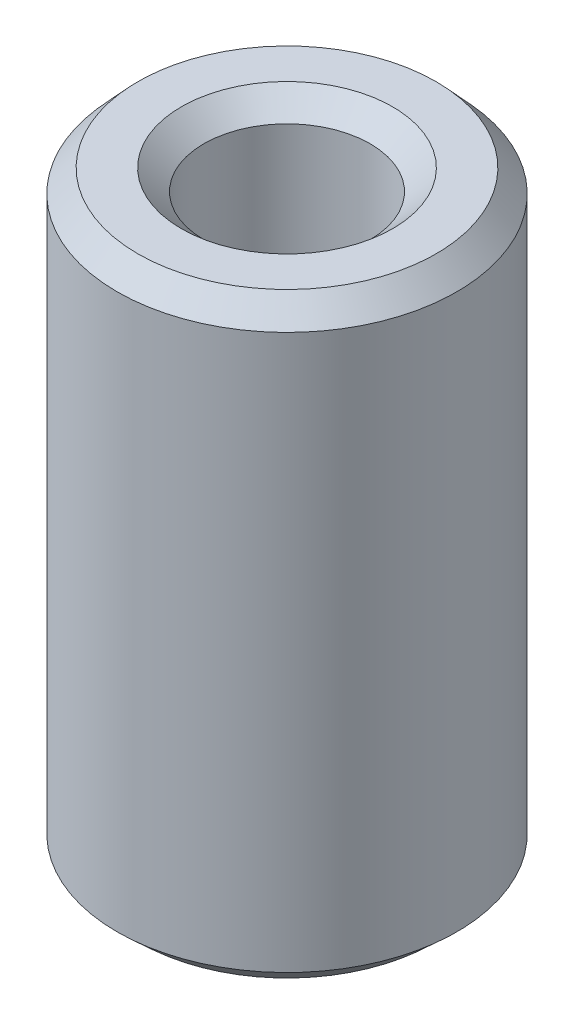
from build123d import *
from OCP.BRepFilletAPI import BRepFilletAPI_MakeChamfer

# Parameters (mm, degrees)
SKETCH1_R           = 15
BOSS_EXTRUDE1_DEPTH = 52.776280472
SKETCH2_R           = 7.339564061
CUT_EXTRUDE1_DEPTH  = 57.880012134
CHAMFER1_SIZE       = 1.990033702
CHAMFER1_SIZE2      = 1.829459394


with BuildPart() as part:
    # Sketch1 → Boss-Extrude1 (new body)
    with BuildSketch(Plane(origin=(0, 0, 0), x_dir=(1, 0, 0), z_dir=(0, 1, 0))):
        Circle(SKETCH1_R)
    extrude(amount=BOSS_EXTRUDE1_DEPTH)

    # Sketch2 → Cut-Extrude1 (cut, through all)
    with BuildSketch(Plane(origin=(0, 0, 0), x_dir=(1, 0, 0), z_dir=(0, 1, 0))):
        Circle(SKETCH2_R)
    extrude(amount=CUT_EXTRUDE1_DEPTH, mode=Mode.SUBTRACT)

    # Chamfer1: one chamfer whose edges measure the first distance from different faces: ONE call of the kernel's chamfer builder (chamfer() names one face for all edges)
    chamfer1_edges_1 = [part.edges().sort_by_distance(p)[0] for p in [
        (-7.339564061, 52.776280472, 0),
    ]]
    chamfer1_side_1 = [part.faces().sort_by_distance(p)[0] for p in [
        (-14.575735931, 52.776280472, 0),
    ]]
    chamfer1_edges_2 = [part.edges().sort_by_distance(p)[0] for p in [
        (-7.339564061, 0, 0),
    ]]
    chamfer1_side_2 = [part.faces().sort_by_distance(p)[0] for p in [
        (-7.339564061, 26.388140236, 0),
    ]]
    chamfer1_edges_3 = [part.edges().sort_by_distance(p)[0] for p in [
        (-15, 0, 0),
    ]]
    chamfer1_side_3 = [part.faces().sort_by_distance(p)[0] for p in [
        (-14.575735931, 0, 0),
    ]]
    chamfer1_edges_4 = [part.edges().sort_by_distance(p)[0] for p in [
        (-15, 52.776280472, 0),
    ]]
    chamfer1_side_4 = [part.faces().sort_by_distance(p)[0] for p in [
        (-15, 26.388140236, 0),
    ]]
    chamfer1 = BRepFilletAPI_MakeChamfer(part.part.solid().wrapped)
    for e in chamfer1_edges_1:
        chamfer1.Add(CHAMFER1_SIZE, CHAMFER1_SIZE2, e.wrapped, chamfer1_side_1[0].wrapped)  # the first distance lies on this face
    for e in chamfer1_edges_2:
        chamfer1.Add(CHAMFER1_SIZE, CHAMFER1_SIZE2, e.wrapped, chamfer1_side_2[0].wrapped)  # the first distance lies on this face
    for e in chamfer1_edges_3:
        chamfer1.Add(CHAMFER1_SIZE, CHAMFER1_SIZE2, e.wrapped, chamfer1_side_3[0].wrapped)  # the first distance lies on this face
    for e in chamfer1_edges_4:
        chamfer1.Add(CHAMFER1_SIZE, CHAMFER1_SIZE2, e.wrapped, chamfer1_side_4[0].wrapped)  # the first distance lies on this face
    add(Compound.cast(chamfer1.Shape()), mode=Mode.REPLACE)


solid = part.part
